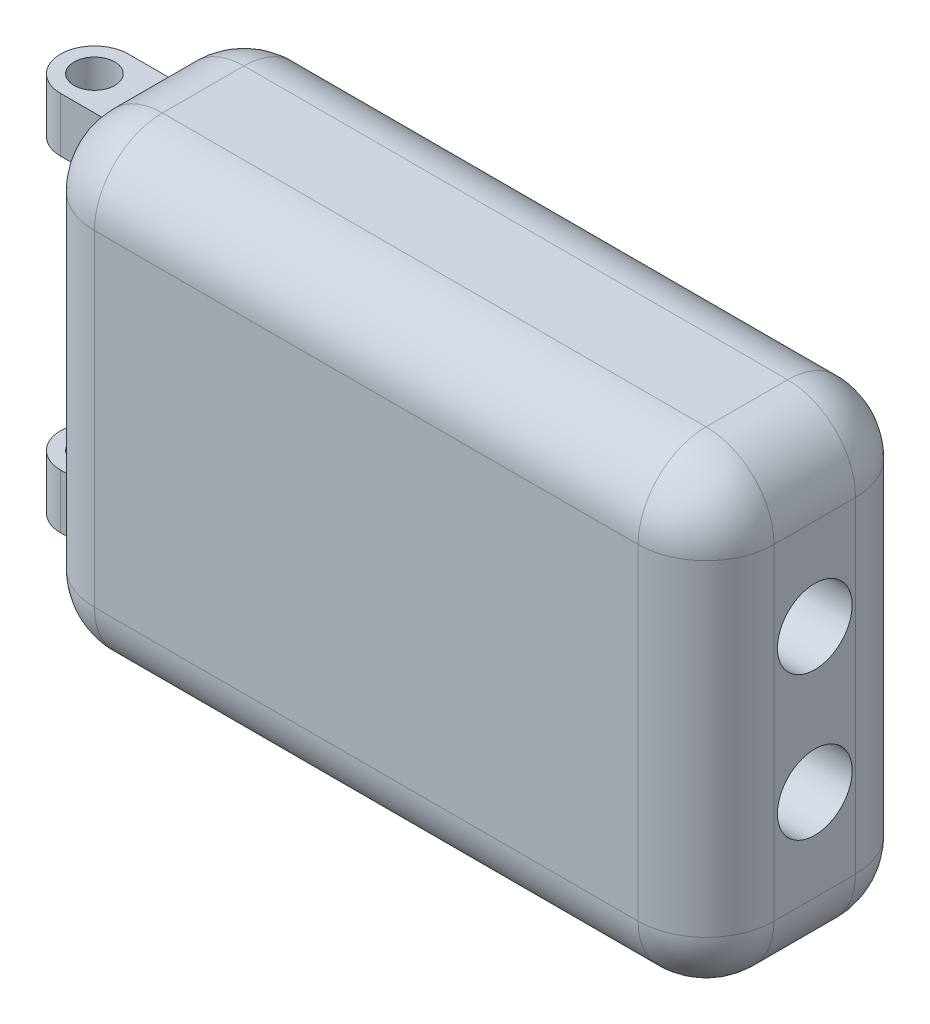
from build123d import *

# Parameters (mm, degrees)
ESQUISSE1_W              = 50
ESQUISSE1_H              = 34
BOSS_EXTRU_1_DEPTH       = 30
ESQUISSE10_R             = 1.5
BOSS_EXTRU_3_DEPTH       = 7
ENL_V_MAT_EXTRU_6_DEPTH  = 45
ESQUISSE12_R             = 2.75
ENL_V_MAT_EXTRU_7_DEPTH  = 68.498148123
ESQUISSE13_W             = 7
ESQUISSE13_H             = 34
ENL_V_MAT_EXTRU_8_DEPTH  = 68.498148123
ESQUISSE15_W             = 7.132262806
ESQUISSE15_H             = 5.57489061
ENL_V_MAT_EXTRU_9_DEPTH  = 3
ENL_V_MAT_EXTRU_10_DEPTH = 3
CONG_1_R                 = 5


with BuildPart() as part:
    # Esquisse1 → Boss.-Extru.1 (new body)
    with BuildSketch(Plane.XY):
        with Locations((25, 17)):
            Rectangle(ESQUISSE1_W, ESQUISSE1_H)
    extrude(amount=BOSS_EXTRU_1_DEPTH)

    # Esquisse10 → Boss.-Extru.3 (add)
    with BuildSketch(Plane(origin=(0, 34, 0), x_dir=(1, 0, 0), z_dir=(0, 1, 0))):
        with BuildLine():
            Line((0, -12.5), (0, -17.5))
            Line((0, -17.5), (-3, -17.5))
            ThreePointArc((-3, -17.5), (-5.5, -15), (-3, -12.5))
            Line((-3, -12.5), (0, -12.5))
        make_face()
        with Locations(Location((-3, -15, 0), (0, 0, 270))):
            Circle(ESQUISSE10_R, mode=Mode.SUBTRACT)
    boss_extru_3 = extrude(amount=-BOSS_EXTRU_3_DEPTH)

    # Symétrie2: Boss.-Extru.3 across plane
    add(boss_extru_3.mirror(Plane.ZX.offset(17)))

    # Esquisse11 → Enlèv. mat.-Extru.6 (cut)
    with BuildSketch(Plane.ZY):
        Polygon((10.381197846, 11.725), (12.690598923, 7.725), (17.309401077, 7.725), (19.618802154, 11.725), (17.309401077, 15.725), (12.690598923, 15.725), align=None)
        Polygon((10.381197846, 22.275), (12.690598923, 18.275), (17.309401077, 18.275), (19.618802154, 22.275), (17.309401077, 26.275), (12.690598923, 26.275), align=None)
    extrude(amount=-ENL_V_MAT_EXTRU_6_DEPTH, mode=Mode.SUBTRACT)

    # Esquisse12 → Enlèv. mat.-Extru.7 (cut, through all)
    with BuildSketch(Plane.ZY):
        with Locations((15, 11.725)):
            Circle(ESQUISSE12_R)
        with Locations((15, 22.275)):
            Circle(ESQUISSE12_R)
    extrude(amount=-ENL_V_MAT_EXTRU_7_DEPTH, mode=Mode.SUBTRACT)

    # Esquisse13 → Enlèv. mat.-Extru.8 (cut, through all)
    with BuildSketch(Plane.ZY):
        with Locations((3.5, 17)):
            Rectangle(ESQUISSE13_W, ESQUISSE13_H)
        with Locations((26.5, 17)):
            Rectangle(ESQUISSE13_W, ESQUISSE13_H)
    extrude(amount=-ENL_V_MAT_EXTRU_8_DEPTH, mode=Mode.SUBTRACT)

    # Esquisse15 → Enlèv. mat.-Extru.9 (cut)
    with BuildSketch(Plane(origin=(0, 34, 0), x_dir=(1, 0, 0), z_dir=(0, 1, 0))):
        with Locations((-3.566131403, -15.287445305)):
            Rectangle(ESQUISSE15_W, ESQUISSE15_H)
    extrude(amount=-ENL_V_MAT_EXTRU_9_DEPTH, mode=Mode.SUBTRACT)

    # Esquisse16 → Enlèv. mat.-Extru.10 (cut)
    with BuildSketch(Plane.XZ):
        Polygon((-3, 18.464101615), (-6, 16.732050808), (-6, 13.267949192), (-3, 11.535898385), (0, 11.535898385), (0, 13.267949192), (0, 16.732050808), (0, 18.464101615), align=None)
    extrude(amount=-ENL_V_MAT_EXTRU_10_DEPTH, mode=Mode.SUBTRACT)

    # Congé1
    # the kernel refuses this fillet: 5 mm, written as the material it takes off along each edge
    with BuildSketch(Plane(origin=(5, 29, 18), x_dir=(0, 0, 1), z_dir=(0, 1, 0))) as cong_1_piece_1_section:
        Polygon((0, 0), (CONG_1_R, 0), (CONG_1_R, -CONG_1_R), (0, -CONG_1_R), align=None)
    cong_1_piece_1 = extrude(amount=CONG_1_R, mode=Mode.PRIVATE)
    cong_1_piece_1 = cong_1_piece_1 - Plane(origin=(5, 29, 18), x_dir=(0.7071067811865475, 0, -0.7071067811865475), z_dir=(0, 1, 0)) * Sphere(CONG_1_R, mode=Mode.PRIVATE)
    add(cong_1_piece_1, mode=Mode.SUBTRACT)
    with BuildSketch(Plane(origin=(45, 29, 18), x_dir=(0, 1, 0), z_dir=(1, 0, 0))) as cong_1_piece_2_section:
        Polygon((0, 0), (CONG_1_R, 0), (CONG_1_R, CONG_1_R), (0, CONG_1_R), align=None)
    cong_1_piece_2 = extrude(amount=CONG_1_R, mode=Mode.PRIVATE)
    cong_1_piece_2 = cong_1_piece_2 - Plane(origin=(45, 29, 18), x_dir=(0, -0.7071067811865475, -0.7071067811865475), z_dir=(1, 0, 0)) * Sphere(CONG_1_R, mode=Mode.PRIVATE)
    add(cong_1_piece_2, mode=Mode.SUBTRACT)
    with BuildSketch(Plane(origin=(5, 29, 12), x_dir=(0, 1, 0), z_dir=(0, 0, -1))) as cong_1_piece_3_section:
        Polygon((0, 0), (CONG_1_R, 0), (CONG_1_R, -CONG_1_R), (0, -CONG_1_R), align=None)
    cong_1_piece_3 = extrude(amount=CONG_1_R, mode=Mode.PRIVATE)
    cong_1_piece_3 = cong_1_piece_3 - Plane(origin=(5, 29, 12), x_dir=(0.7071067811865475, -0.7071067811865475, 0), z_dir=(0, 0, -1)) * Sphere(CONG_1_R, mode=Mode.PRIVATE)
    add(cong_1_piece_3, mode=Mode.SUBTRACT)
    with BuildSketch(Plane(origin=(45, 29, 12), x_dir=(0, 1, 0), z_dir=(0, 0, -1))) as cong_1_piece_4_section:
        Polygon((0, 0), (CONG_1_R, 0), (CONG_1_R, CONG_1_R), (0, CONG_1_R), align=None)
    cong_1_piece_4 = extrude(amount=CONG_1_R, mode=Mode.PRIVATE)
    cong_1_piece_4 = cong_1_piece_4 - Plane(origin=(45, 29, 12), x_dir=(-0.7071067811865475, -0.7071067811865475, 0), z_dir=(0, 0, -1)) * Sphere(CONG_1_R, mode=Mode.PRIVATE)
    add(cong_1_piece_4, mode=Mode.SUBTRACT)
    with BuildSketch(Plane(origin=(5, 5, 12), x_dir=(0, 0, -1), z_dir=(0, -1, 0))) as cong_1_piece_5_section:
        Polygon((0, 0), (CONG_1_R, 0), (CONG_1_R, -CONG_1_R), (0, -CONG_1_R), align=None)
    cong_1_piece_5 = extrude(amount=CONG_1_R, mode=Mode.PRIVATE)
    cong_1_piece_5 = cong_1_piece_5 - Plane(origin=(5, 5, 12), x_dir=(0.7071067811865475, 0, 0.7071067811865475), z_dir=(0, -1, 0)) * Sphere(CONG_1_R, mode=Mode.PRIVATE)
    add(cong_1_piece_5, mode=Mode.SUBTRACT)
    with BuildSketch(Plane(origin=(45, 5, 12), x_dir=(0, 0, -1), z_dir=(0, -1, 0))) as cong_1_piece_6_section:
        Polygon((0, 0), (CONG_1_R, 0), (CONG_1_R, CONG_1_R), (0, CONG_1_R), align=None)
    cong_1_piece_6 = extrude(amount=CONG_1_R, mode=Mode.PRIVATE)
    cong_1_piece_6 = cong_1_piece_6 - Plane(origin=(45, 5, 12), x_dir=(-0.7071067811865475, 0, 0.7071067811865475), z_dir=(0, -1, 0)) * Sphere(CONG_1_R, mode=Mode.PRIVATE)
    add(cong_1_piece_6, mode=Mode.SUBTRACT)
    with BuildSketch(Plane(origin=(5, 5, 18), x_dir=(0, 0, 1), z_dir=(0, -1, 0))) as cong_1_piece_7_section:
        Polygon((0, 0), (CONG_1_R, 0), (CONG_1_R, CONG_1_R), (0, CONG_1_R), align=None)
    cong_1_piece_7 = extrude(amount=CONG_1_R, mode=Mode.PRIVATE)
    cong_1_piece_7 = cong_1_piece_7 - Plane(origin=(5, 5, 18), x_dir=(0.7071067811865475, 0, -0.7071067811865475), z_dir=(0, -1, 0)) * Sphere(CONG_1_R, mode=Mode.PRIVATE)
    add(cong_1_piece_7, mode=Mode.SUBTRACT)
    with BuildSketch(Plane(origin=(45, 5, 18), x_dir=(1, 0, 0), z_dir=(0, -1, 0))) as cong_1_piece_8_section:
        Polygon((0, 0), (CONG_1_R, 0), (CONG_1_R, CONG_1_R), (0, CONG_1_R), align=None)
    cong_1_piece_8 = extrude(amount=CONG_1_R, mode=Mode.PRIVATE)
    cong_1_piece_8 = cong_1_piece_8 - Plane(origin=(45, 5, 18), x_dir=(-0.7071067811865475, 0, -0.7071067811865475), z_dir=(0, -1, 0)) * Sphere(CONG_1_R, mode=Mode.PRIVATE)
    add(cong_1_piece_8, mode=Mode.SUBTRACT)
    with BuildSketch(Plane(origin=(5, 34, 23), x_dir=(0, 0, -1), z_dir=(1, 0, 0)), Plane(origin=(5, 0, 7), x_dir=(0, 0, 1), z_dir=(1, 0, 0))) as cong_1_piece_9:
        with BuildLine():
            CenterArc((CONG_1_R, -CONG_1_R), CONG_1_R, 90, 90)
            Line((0, -CONG_1_R), (0, 0))
            Line((0, 0), (CONG_1_R, 0))
        make_face()
    extrude(amount=40, mode=Mode.SUBTRACT)
    with BuildSketch(Plane(origin=(5, 34, 7), x_dir=(0, 0, 1), z_dir=(1, 0, 0)), Plane(origin=(5, 0, 23), x_dir=(0, 0, -1), z_dir=(1, 0, 0))) as cong_1_piece_10:
        with BuildLine():
            CenterArc((CONG_1_R, CONG_1_R), CONG_1_R, 180, 90)
            Line((0, CONG_1_R), (0, 0))
            Line((0, 0), (CONG_1_R, 0))
        make_face()
    extrude(amount=40, mode=Mode.SUBTRACT)
    with BuildSketch(Plane(origin=(0, 5, 23), x_dir=(1, 0, 0), z_dir=(0, 1, 0)), Plane(origin=(0, 5, 7), x_dir=(0, 0, 1), z_dir=(0, 1, 0)), Plane(origin=(50, 5, 23), x_dir=(0, 0, -1), z_dir=(0, 1, 0))) as cong_1_piece_11:
        with BuildLine():
            CenterArc((CONG_1_R, CONG_1_R), CONG_1_R, 180, 90)
            Line((0, CONG_1_R), (0, 0))
            Line((0, 0), (CONG_1_R, 0))
        make_face()
    extrude(amount=24, mode=Mode.SUBTRACT)
    with BuildSketch(Plane(origin=(0, 34, 18), x_dir=(1, 0, 0), z_dir=(0, 0, -1))) as cong_1_piece_12_section:
        with BuildLine():
            CenterArc((CONG_1_R, CONG_1_R), CONG_1_R, 180, 90)
            Line((0, CONG_1_R), (0, 0))
            Line((0, 0), (CONG_1_R, 0))
        make_face()
    cong_1_piece_12 = extrude(amount=6, mode=Mode.PRIVATE)
    cong_1_piece_12 = split(cong_1_piece_12, bisect_by=Plane(origin=(1.218725878, 33.074749682, 17.5), z_dir=(0, 0, 1)), keep=Keep.TOP, mode=Mode.PRIVATE)
    cong_1_piece_12 = split(cong_1_piece_12, bisect_by=Plane(origin=(1.218725878, 31, 17.75), z_dir=(0, 1, 0)), keep=Keep.TOP, mode=Mode.PRIVATE)
    add(cong_1_piece_12, mode=Mode.SUBTRACT)
    with BuildSketch(Plane(origin=(0, 34, 18), x_dir=(1, 0, 0), z_dir=(0, 0, -1))) as cong_1_piece_13_section:
        with BuildLine():
            CenterArc((CONG_1_R, CONG_1_R), CONG_1_R, 180, 90)
            Line((0, CONG_1_R), (0, 0))
            Line((0, 0), (CONG_1_R, 0))
        make_face()
    cong_1_piece_13 = extrude(amount=6, mode=Mode.PRIVATE)
    cong_1_piece_13 = split(cong_1_piece_13, bisect_by=Plane(origin=(0.05065924, 30.291256669, 17.5), z_dir=(0, 0, 1)), keep=Keep.TOP, mode=Mode.PRIVATE)
    cong_1_piece_13 = split(cong_1_piece_13, bisect_by=Plane(origin=(0.05065924, 31, 17.75), z_dir=(0, -1, 0)), keep=Keep.TOP, mode=Mode.PRIVATE)
    add(cong_1_piece_13, mode=Mode.SUBTRACT)
    with BuildSketch(Plane(origin=(0, 34, 18), x_dir=(1, 0, 0), z_dir=(0, 0, -1))) as cong_1_piece_14_section:
        with BuildLine():
            CenterArc((CONG_1_R, CONG_1_R), CONG_1_R, 180, 90)
            Line((0, CONG_1_R), (0, 0))
            Line((0, 0), (CONG_1_R, 0))
        make_face()
    cong_1_piece_14 = extrude(amount=6, mode=Mode.PRIVATE)
    cong_1_piece_14 = split(cong_1_piece_14, bisect_by=Plane(origin=(1.218725878, 33.074749682, 17.5), z_dir=(0, 0, -1)), keep=Keep.TOP, mode=Mode.PRIVATE)
    cong_1_piece_14 = split(cong_1_piece_14, bisect_by=Plane(origin=(1.218725878, 31, 15), z_dir=(0, 1, 0)), keep=Keep.TOP, mode=Mode.PRIVATE)
    cong_1_piece_14 = split(cong_1_piece_14, bisect_by=Plane(origin=(1.218725878, 33.074749682, 12.5), z_dir=(0, 0, 1)), keep=Keep.TOP, mode=Mode.PRIVATE)
    add(cong_1_piece_14, mode=Mode.SUBTRACT)
    with BuildSketch(Plane(origin=(0, 34, 18), x_dir=(1, 0, 0), z_dir=(0, 0, -1))) as cong_1_piece_15_section:
        with BuildLine():
            CenterArc((CONG_1_R, CONG_1_R), CONG_1_R, 180, 90)
            Line((0, CONG_1_R), (0, 0))
            Line((0, 0), (CONG_1_R, 0))
        make_face()
    cong_1_piece_15 = extrude(amount=6, mode=Mode.PRIVATE)
    cong_1_piece_15 = split(cong_1_piece_15, bisect_by=Plane(origin=(1.218725878, 31, 12.25), z_dir=(0, 1, 0)), keep=Keep.TOP, mode=Mode.PRIVATE)
    cong_1_piece_15 = split(cong_1_piece_15, bisect_by=Plane(origin=(1.218725878, 33.074749682, 12.5), z_dir=(0, 0, -1)), keep=Keep.TOP, mode=Mode.PRIVATE)
    add(cong_1_piece_15, mode=Mode.SUBTRACT)
    with BuildSketch(Plane(origin=(0, 34, 18), x_dir=(1, 0, 0), z_dir=(0, 0, -1))) as cong_1_piece_16_section:
        with BuildLine():
            CenterArc((CONG_1_R, CONG_1_R), CONG_1_R, 180, 90)
            Line((0, CONG_1_R), (0, 0))
            Line((0, 0), (CONG_1_R, 0))
        make_face()
    cong_1_piece_16 = extrude(amount=6, mode=Mode.PRIVATE)
    cong_1_piece_16 = split(cong_1_piece_16, bisect_by=Plane(origin=(0.05065924, 31, 12.25), z_dir=(0, -1, 0)), keep=Keep.TOP, mode=Mode.PRIVATE)
    cong_1_piece_16 = split(cong_1_piece_16, bisect_by=Plane(origin=(0.05065924, 30.291256669, 12.5), z_dir=(0, 0, -1)), keep=Keep.TOP, mode=Mode.PRIVATE)
    add(cong_1_piece_16, mode=Mode.SUBTRACT)
    with BuildSketch(Plane(origin=(0, 0, 18), x_dir=(1, 0, 0), z_dir=(0, 0, -1))) as cong_1_piece_17_section:
        with BuildLine():
            CenterArc((CONG_1_R, -CONG_1_R), CONG_1_R, 90, 90)
            Line((0, -CONG_1_R), (0, 0))
            Line((0, 0), (CONG_1_R, 0))
        make_face()
    cong_1_piece_17 = extrude(amount=6, mode=Mode.PRIVATE)
    cong_1_piece_17 = split(cong_1_piece_17, bisect_by=Plane(origin=(1.218725878, 3, 17.75), z_dir=(0, -1, 0)), keep=Keep.TOP, mode=Mode.PRIVATE)
    cong_1_piece_17 = split(cong_1_piece_17, bisect_by=Plane(origin=(1.218725878, 0.925250318, 17.5), z_dir=(0, 0, 1)), keep=Keep.TOP, mode=Mode.PRIVATE)
    add(cong_1_piece_17, mode=Mode.SUBTRACT)
    with BuildSketch(Plane(origin=(0, 0, 18), x_dir=(1, 0, 0), z_dir=(0, 0, -1))) as cong_1_piece_18_section:
        with BuildLine():
            CenterArc((CONG_1_R, -CONG_1_R), CONG_1_R, 90, 90)
            Line((0, -CONG_1_R), (0, 0))
            Line((0, 0), (CONG_1_R, 0))
        make_face()
    cong_1_piece_18 = extrude(amount=6, mode=Mode.PRIVATE)
    cong_1_piece_18 = split(cong_1_piece_18, bisect_by=Plane(origin=(0.05065924, 3, 17.75), z_dir=(0, 1, 0)), keep=Keep.TOP, mode=Mode.PRIVATE)
    cong_1_piece_18 = split(cong_1_piece_18, bisect_by=Plane(origin=(0.05065924, 3.708743331, 17.5), z_dir=(0, 0, 1)), keep=Keep.TOP, mode=Mode.PRIVATE)
    add(cong_1_piece_18, mode=Mode.SUBTRACT)
    with BuildSketch(Plane(origin=(0, 0, 18), x_dir=(1, 0, 0), z_dir=(0, 0, -1))) as cong_1_piece_19_section:
        with BuildLine():
            CenterArc((CONG_1_R, -CONG_1_R), CONG_1_R, 90, 90)
            Line((0, -CONG_1_R), (0, 0))
            Line((0, 0), (CONG_1_R, 0))
        make_face()
    cong_1_piece_19 = extrude(amount=6, mode=Mode.PRIVATE)
    cong_1_piece_19 = split(cong_1_piece_19, bisect_by=Plane(origin=(1.218725878, 0.925250318, 12.5), z_dir=(0, 0, 1)), keep=Keep.TOP, mode=Mode.PRIVATE)
    cong_1_piece_19 = split(cong_1_piece_19, bisect_by=Plane(origin=(1.218725878, 3, 15), z_dir=(0, -1, 0)), keep=Keep.TOP, mode=Mode.PRIVATE)
    cong_1_piece_19 = split(cong_1_piece_19, bisect_by=Plane(origin=(1.218725878, 0.925250318, 17.5), z_dir=(0, 0, -1)), keep=Keep.TOP, mode=Mode.PRIVATE)
    add(cong_1_piece_19, mode=Mode.SUBTRACT)
    with BuildSketch(Plane(origin=(0, 0, 18), x_dir=(1, 0, 0), z_dir=(0, 0, -1))) as cong_1_piece_20_section:
        with BuildLine():
            CenterArc((CONG_1_R, -CONG_1_R), CONG_1_R, 90, 90)
            Line((0, -CONG_1_R), (0, 0))
            Line((0, 0), (CONG_1_R, 0))
        make_face()
    cong_1_piece_20 = extrude(amount=6, mode=Mode.PRIVATE)
    cong_1_piece_20 = split(cong_1_piece_20, bisect_by=Plane(origin=(1.218725878, 0.925250318, 12.5), z_dir=(0, 0, -1)), keep=Keep.TOP, mode=Mode.PRIVATE)
    cong_1_piece_20 = split(cong_1_piece_20, bisect_by=Plane(origin=(1.218725878, 3, 12.25), z_dir=(0, -1, 0)), keep=Keep.TOP, mode=Mode.PRIVATE)
    add(cong_1_piece_20, mode=Mode.SUBTRACT)
    with BuildSketch(Plane(origin=(0, 0, 18), x_dir=(1, 0, 0), z_dir=(0, 0, -1))) as cong_1_piece_21_section:
        with BuildLine():
            CenterArc((CONG_1_R, -CONG_1_R), CONG_1_R, 90, 90)
            Line((0, -CONG_1_R), (0, 0))
            Line((0, 0), (CONG_1_R, 0))
        make_face()
    cong_1_piece_21 = extrude(amount=6, mode=Mode.PRIVATE)
    cong_1_piece_21 = split(cong_1_piece_21, bisect_by=Plane(origin=(0.05065924, 3.708743331, 12.5), z_dir=(0, 0, -1)), keep=Keep.TOP, mode=Mode.PRIVATE)
    cong_1_piece_21 = split(cong_1_piece_21, bisect_by=Plane(origin=(0.05065924, 3, 12.25), z_dir=(0, 1, 0)), keep=Keep.TOP, mode=Mode.PRIVATE)
    add(cong_1_piece_21, mode=Mode.SUBTRACT)
    with BuildSketch(Plane(origin=(50, 0, 12), x_dir=(-1, 0, 0), z_dir=(0, 0, 1)), Plane(origin=(50, 34, 12), x_dir=(0, -1, 0), z_dir=(0, 0, 1))) as cong_1_piece_22:
        with BuildLine():
            CenterArc((CONG_1_R, -CONG_1_R), CONG_1_R, 90, 90)
            Line((0, -CONG_1_R), (0, 0))
            Line((0, 0), (CONG_1_R, 0))
        make_face()
    extrude(amount=6, mode=Mode.SUBTRACT)
    with BuildSketch(Plane(origin=(50, 5, 7), x_dir=(0, 0, 1), z_dir=(0, 1, 0))) as cong_1_piece_23:
        with BuildLine():
            CenterArc((CONG_1_R, -CONG_1_R), CONG_1_R, 90, 90)
            Line((0, -CONG_1_R), (0, 0))
            Line((0, 0), (CONG_1_R, 0))
        make_face()
    extrude(amount=24, mode=Mode.SUBTRACT)


solid = part.part
